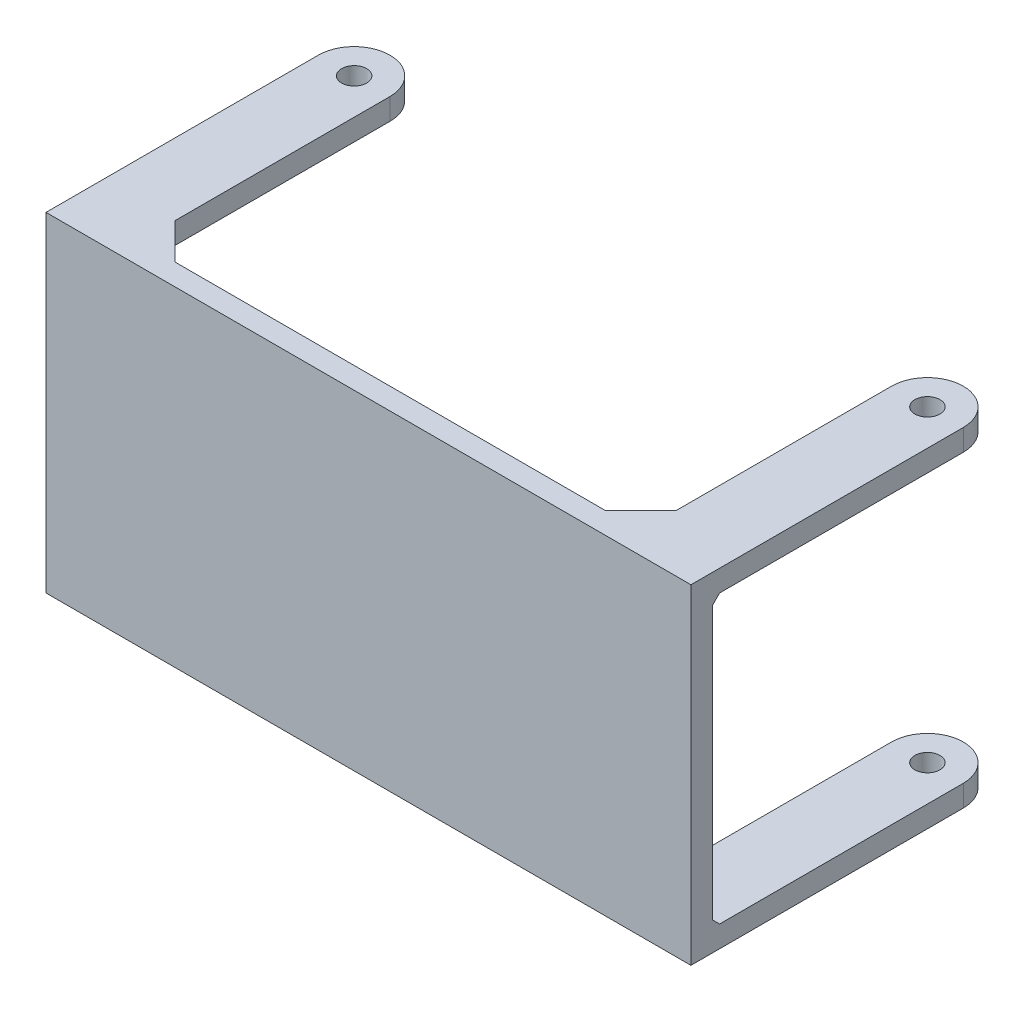
from build123d import *

# Parameters (mm, degrees)
SZKIC1_W                    = 90
SZKIC1_H                    = 46
DODANIE_WYCI_GNI_CIE1_DEPTH = 3
SZKIC2_W                    = 10
SZKIC2_H                    = 3
DODANIE_WYCI_GNI_CIE2_DEPTH = 40
SFAZOWANIE1_SIZE            = 5
SFAZOWANIE2_SIZE            = 1
ZAOKR_GLENIE1_R             = 5
SFAZOWANIE1_OF_LUSTRO1_SIZE = 5
SFAZOWANIE2_OF_LUSTRO1_SIZE = 1
ZAOKR_GLENIE1_OF_LUSTRO1_R  = 5
SZKIC3_R                    = 1.75
WYTNIJ_WYCI_GNI_CIE1_DEPTH  = 76.769386958


with BuildPart() as part:
    # Szkic1 → Dodanie-wyciągnięcie1 (new body)
    with BuildSketch(Plane.XY):
        Rectangle(SZKIC1_W, SZKIC1_H)
    extrude(amount=DODANIE_WYCI_GNI_CIE1_DEPTH)

    # Szkic2 → Dodanie-wyciągnięcie2 (add)
    with BuildSketch(Plane(origin=(0, 0, 0), x_dir=(-1, 0, 0), z_dir=(0, 0, -1))):
        with Locations((-40, 21.5)):
            Rectangle(SZKIC2_W, SZKIC2_H)
        with Locations((40, 21.5)):
            Rectangle(SZKIC2_W, SZKIC2_H)
    dodanie_wyci_gni_cie2 = extrude(amount=DODANIE_WYCI_GNI_CIE2_DEPTH)

    # Sfazowanie1
    sfazowanie1_edges = [part.edges().sort_by_distance(p)[0] for p in [
        (35, 21.5, 0),
        (-35, 21.5, 0),
    ]]
    chamfer(sfazowanie1_edges, length=SFAZOWANIE1_SIZE)

    # Sfazowanie2
    sfazowanie2_edges = [part.edges().sort_by_distance(p)[0] for p in [
        (37.5, 20, 0),
        (-37.5, 20, 0),
    ]]
    chamfer(sfazowanie2_edges, length=SFAZOWANIE2_SIZE)

    # Zaokrąglenie1
    zaokr_glenie1_edges = [part.edges().sort_by_distance(p)[0] for p in [
        (35, 21.5, -40),
        (45, 21.5, -40),
        (-35, 21.5, -40),
        (-45, 21.5, -40),
    ]]
    fillet(zaokr_glenie1_edges, radius=ZAOKR_GLENIE1_R - 0.0001)  # a hair under: the kernel refuses the full size

    # Lustro1: Dodanie-wyciągnięcie2 across plane
    add(dodanie_wyci_gni_cie2.mirror(Plane.ZX))

    # Sfazowanie1 of Lustro1
    sfazowanie1_of_lustro1_edges = [part.edges().sort_by_distance(p)[0] for p in [
        (35, -21.5, 0),
        (-35, -21.5, 0),
    ]]
    chamfer(sfazowanie1_of_lustro1_edges, length=SFAZOWANIE1_OF_LUSTRO1_SIZE)

    # Sfazowanie2 of Lustro1
    sfazowanie2_of_lustro1_edges = [part.edges().sort_by_distance(p)[0] for p in [
        (37.5, -20, 0),
        (-37.5, -20, 0),
    ]]
    chamfer(sfazowanie2_of_lustro1_edges, length=SFAZOWANIE2_OF_LUSTRO1_SIZE)

    # Zaokrąglenie1 of Lustro1
    zaokr_glenie1_of_lustro1_edges = [part.edges().sort_by_distance(p)[0] for p in [
        (35, -21.5, -40),
        (45, -21.5, -40),
        (-35, -21.5, -40),
        (-45, -21.5, -40),
    ]]
    fillet(zaokr_glenie1_of_lustro1_edges, radius=ZAOKR_GLENIE1_OF_LUSTRO1_R - 0.0001)  # a hair under: the kernel refuses the full size

    # Szkic3 → Wytnij-wyciągnięcie1 (cut, through all)
    with BuildSketch(Plane(origin=(0, 23, 0), x_dir=(1, 0, 0), z_dir=(0, 1, 0))):
        with Locations(Location((-40, 35, 0), (0, 0, 270))):
            Circle(SZKIC3_R)
        with Locations(Location((40, 35, 0), (0, 0, 270))):
            Circle(SZKIC3_R)
    extrude(amount=-WYTNIJ_WYCI_GNI_CIE1_DEPTH, mode=Mode.SUBTRACT)


solid = part.part
